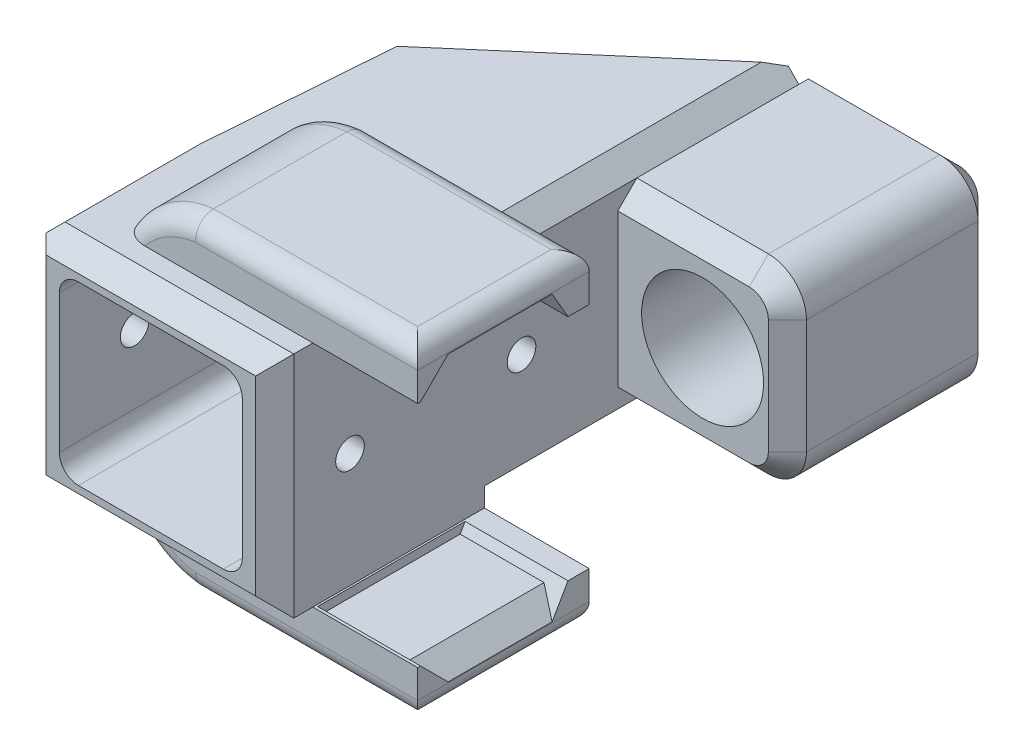
from build123d import *

# Parameters (mm, degrees)
SKETCH2_W                = 13
SKETCH2_H                = 12
BOSS_EXTRUDE3_DEPTH      = 29
CUT_EXTRUDE2_DEPTH       = 17.2
SKETCH5_W                = 15.5
SKETCH5_H                = 2.5
CUT_EXTRUDE3_DEPTH       = 2
CHAMFER4_SIZE            = 1
SKETCH6_W                = 15.5
SKETCH6_H                = 18
CUT_EXTRUDE4_DEPTH       = 2.5
SKETCH8_W                = 15.5
SKETCH8_H                = 18
CUT_EXTRUDE5_DEPTH       = 2.5
BOSS_EXTRUDE4_DEPTH      = 8.9
SKETCH10_R               = 3.2
CUT_EXTRUDE6_DEPTH       = 11
SKETCH11_W               = 13
SKETCH11_H               = 12
CUT_EXTRUDE7_DEPTH       = 1.5
FILLET1_R                = 2
CHAMFER5_SIZE            = 1
CUT_EXTRUDE9_DEPTH       = 36.894428537
CHAMFER6_SIZE            = 1
CHAMFER6_SIZE_2          = 9.42392311
CUT_EXTRUDE11_DEPTH      = 11.5
CHAMFER7_SIZE            = 1
FILLET2_R                = 1
CUT_EXTRUDE12_DEPTH      = 33.897568325
CUT_EXTRUDE12_DEPTH_BACK = 33.897568325
SKETCH17_R               = 0.75
BOSS_EXTRUDE5_START      = -0.2
SKETCH18_R               = 0.795097265
SKETCH18_R_2             = 0.75
BOSS_EXTRUDE5_DEPTH      = 0.2
SKETCH19_W               = 5.4
SKETCH19_H               = 6.7
CUT_EXTRUDE13_DEPTH      = 6.45
CHAMFER8_SIZE            = 0.75
CHAMFER9_SIZE            = 0.288675135
CHAMFER9_SIZE_2          = 0.5
CHAMFER10_SIZE           = 1


with BuildPart() as part:
    # Sketch2 → Boss-Extrude3 (new body)
    with BuildSketch(Plane.XY):
        Polygon((-3.5, 8.5), (-3.5, 6), (6.5, 6), (12, 6), (12, 8.5), align=None)
        Rectangle(SKETCH2_W, SKETCH2_H)
        Polygon((12, -6), (6.5, -6), (-3.5, -6), (-3.5, -8.5), (12, -8.5), align=None)
    extrude(amount=-BOSS_EXTRUDE3_DEPTH)

    # Sketch4 → Cut-Extrude2 (cut)
    with BuildSketch(Plane.XY):
        with BuildLine():
            Line((-3.8, -4.625), (3.8, -4.625))
            ThreePointArc((3.8, -4.625), (4.507106781, -4.332106781), (4.8, -3.625))
            Line((4.8, -3.625), (4.8, 3.625))
            ThreePointArc((4.8, 3.625), (4.507106781, 4.332106781), (3.8, 4.625))
            Line((3.8, 4.625), (-3.8, 4.625))
            ThreePointArc((-3.8, 4.625), (-4.507106781, 4.332106781), (-4.8, 3.625))
            Line((-4.8, 3.625), (-4.8, -3.625))
            ThreePointArc((-4.8, -3.625), (-4.507106781, -4.332106781), (-3.8, -4.625))
        make_face()
    extrude(amount=-CUT_EXTRUDE2_DEPTH, mode=Mode.SUBTRACT)

    # Sketch5 → Cut-Extrude3 (cut)
    with BuildSketch(Plane.XY):
        with Locations((4.25, 7.25)):
            Rectangle(SKETCH5_W, SKETCH5_H)
        with Locations((4.25, -7.25)):
            Rectangle(SKETCH5_W, SKETCH5_H)
    extrude(amount=-CUT_EXTRUDE3_DEPTH, mode=Mode.SUBTRACT)

    # Chamfer4
    chamfer4_edges = [part.edges().sort_by_distance(p)[0] for p in [
        (6.5, 0, 0),
        (0, -6, 0),
        (-6.5, 0, 0),
        (0, 6, 0),
    ]]
    chamfer(chamfer4_edges, length=CHAMFER4_SIZE)

    # Sketch6 → Cut-Extrude4 (cut)
    with BuildSketch(Plane(origin=(0, 8.5, 0), x_dir=(1, 0, 0), z_dir=(0, 1, 0))):
        with Locations((4.25, 20)):
            Rectangle(SKETCH6_W, SKETCH6_H)
    extrude(amount=-CUT_EXTRUDE4_DEPTH, mode=Mode.SUBTRACT)

    # Sketch8 → Cut-Extrude5 (cut)
    with BuildSketch(Plane.XZ.offset(8.5)):
        with Locations((4.25, -20)):
            Rectangle(SKETCH8_W, SKETCH8_H)
    extrude(amount=-CUT_EXTRUDE5_DEPTH, mode=Mode.SUBTRACT)

    # Sketch9 → Boss-Extrude4 (add)
    with BuildSketch(Plane(origin=(6.5, 0, 0), x_dir=(0, 0, -1), z_dir=(1, 0, 0))):
        Polygon((18, 0), (18, 5), (29, 5), (29, -5), (18, -5), align=None)
    extrude(amount=BOSS_EXTRUDE4_DEPTH)

    # Sketch10 → Cut-Extrude6 (cut)
    with BuildSketch(Plane.XY.offset(-18)):
        with Locations((10.95, 0)):
            Circle(SKETCH10_R)
    extrude(amount=-CUT_EXTRUDE6_DEPTH, mode=Mode.SUBTRACT)

    # Sketch11 → Cut-Extrude7 (cut)
    with BuildSketch(Plane(origin=(0, 0, -29), x_dir=(-1, 0, 0), z_dir=(0, 0, -1))):
        Rectangle(SKETCH11_W, SKETCH11_H)
    extrude(amount=-CUT_EXTRUDE7_DEPTH, mode=Mode.SUBTRACT)

    # Fillet1
    fillet1_edges = [part.edges().sort_by_distance(p)[0] for p in [
        (15.4, -5, -23.5),
        (15.4, 5, -23.5),
    ]]
    fillet(fillet1_edges, radius=FILLET1_R)

    # Chamfer5
    chamfer5_edges = [part.edges().sort_by_distance(p)[0] for p in [
        (6.5, 0, -29),
        (15.4, 0, -18),
        (15.4, 0, -29),
        (9.95, -5, -18),
        (9.95, 5, -18),
        (14.814213562, -4.414213562, -18),
        (14.814213562, 4.414213562, -18),
        (9.95, 5, -29),
        (9.95, -5, -29),
        (14.814213562, -4.414213562, -29),
        (14.814213562, 4.414213562, -29),
    ]]
    chamfer(chamfer5_edges, length=CHAMFER5_SIZE)

    # Sketch14 → Cut-Extrude9 (cut, through all)
    with BuildSketch(Plane(origin=(0, 6, 0), x_dir=(1, 0, 0), z_dir=(0, 1, 0))):
        Polygon((-6.5, 27.5), (-6.5, 17.523527678), (5.1, 27.5), align=None)
    extrude(amount=-CUT_EXTRUDE9_DEPTH, mode=Mode.SUBTRACT)

    # Chamfer6
    # the kernel refuses this chamfer: 9.42392311, 1 mm, written as the material it takes off along each edge
    with BuildSketch(Plane(origin=(-6.5, 30.49964556, -17.523527678), x_dir=(0.6076323251889422, 0, -0.794218456966016), z_dir=(0, -1, 0))) as chamfer6_piece_1:
        Polygon((CHAMFER6_SIZE * 0.978564276214, CHAMFER6_SIZE * 0.205941635709), (-CHAMFER6_SIZE_2 * 0.794218456941, CHAMFER6_SIZE_2 * 0.60763232517), (0, 0), align=None)
    extrude(amount=60.999291121, mode=Mode.SUBTRACT)
    # the kernel refuses this chamfer: 9.42392311, 1 mm, written as the material it takes off along each edge
    with BuildSketch(Plane(origin=(-7.691602788, -6, -16.498700761), x_dir=(0.6518104828071479, -0.027495876610586452, 0.757883283409872), z_dir=(0.7581699346405228, 0, -0.6520570145372148))) as chamfer6_2_piece_1:
        Polygon((CHAMFER6_SIZE * 0.999621916911, -CHAMFER6_SIZE * 0.0274958766106), (-CHAMFER6_SIZE * 0.0274958766106, -CHAMFER6_SIZE * 0.999621916911), (0, 0), align=None)
    extrude(amount=19.443365976, mode=Mode.SUBTRACT)
    with BuildSketch(Plane(origin=(-7.691602788, 6, -16.498700761), x_dir=(0.6518104828071478, 0.02749587661058648, 0.757883283409872), z_dir=(0.7581699346405228, 0, -0.6520570145372148))) as chamfer6_2_piece_2:
        Polygon((CHAMFER6_SIZE * 0.999621916911, CHAMFER6_SIZE * 0.0274958766106), (-CHAMFER6_SIZE * 0.0274958766106, CHAMFER6_SIZE * 0.999621916911), (0, 0), align=None)
    extrude(amount=19.443365976, mode=Mode.SUBTRACT)

    # Sketch16 → Cut-Extrude11 (cut)
    with BuildSketch(Plane.XY.offset(-2)):
        with BuildLine():
            ThreePointArc((-3.5, 6), (-1.902802726, 7.706126426), (0.295303565, 8.5))
            Line((0.295303565, 8.5), (-3.5, 8.5))
            Line((-3.5, 8.5), (-3.5, 6))
        make_face()
        with BuildLine():
            Line((-3.5, -8.5), (0.295303565, -8.5))
            ThreePointArc((0.295303565, -8.5), (-1.902802726, -7.706126426), (-3.5, -6))
            Line((-3.5, -6), (-3.5, -8.5))
        make_face()
    extrude(amount=-CUT_EXTRUDE11_DEPTH, mode=Mode.SUBTRACT)

    # Chamfer7
    # the kernel refuses this chamfer: 1 mm, written as the material it takes off along each edge
    with BuildSketch(Plane(origin=(6.5, -6, -11), x_dir=(0.027495876610586487, 0.9996219169112968, 0), z_dir=(0, 0, -1))) as chamfer7_piece_1:
        Polygon((CHAMFER7_SIZE * 0.999621916911, -CHAMFER7_SIZE * 0.0274958766106), (-CHAMFER7_SIZE * 0.0274958766106, -CHAMFER7_SIZE * 0.999621916911), (0, 0), align=None)
    extrude(amount=18.956774475, mode=Mode.SUBTRACT)
    with BuildSketch(Plane(origin=(-6.5, -6, 1.571682988), x_dir=(0.9996219169112968, -0.027495876610586487, 0), z_dir=(0, 0, -1))) as chamfer7_piece_2:
        Polygon((CHAMFER7_SIZE * 0.999621916911, -CHAMFER7_SIZE * 0.0274958766106), (-CHAMFER7_SIZE * 0.0274958766106, -CHAMFER7_SIZE * 0.999621916911), (0, 0), align=None)
    extrude(amount=12.242970544, mode=Mode.SUBTRACT)
    with BuildSketch(Plane(origin=(-5.654981471, -6, -19.329791256), x_dir=(0.9968040214884636, -0.02749587661058647, 0.07500479660556608), z_dir=(-0.0750331653764868, 0, 0.9971810387756)), Plane(origin=(-6.692961515, 6, -5.535171055), x_dir=(0.9968040214884636, 0.027495876610586487, 0.07500479660556608), z_dir=(0.0750331653764868, 0, -0.9971810387756))) as chamfer7_piece_3:
        Polygon((CHAMFER7_SIZE * 0.999621916911, CHAMFER7_SIZE * 0.0274958766106), (-CHAMFER7_SIZE * 0.0274958766106, CHAMFER7_SIZE * 0.999621916911), (0, 0), align=None)
    extrude(amount=13.833616631, mode=Mode.SUBTRACT)
    with BuildSketch(Plane(origin=(6.5, 6, -11), x_dir=(0.027495876610586487, -0.9996219169112968, 0), z_dir=(0, 0, -1))) as chamfer7_piece_4:
        Polygon((CHAMFER7_SIZE * 0.999621916911, CHAMFER7_SIZE * 0.0274958766106), (-CHAMFER7_SIZE * 0.0274958766106, CHAMFER7_SIZE * 0.999621916911), (0, 0), align=None)
    extrude(amount=18.956774475, mode=Mode.SUBTRACT)
    with BuildSketch(Plane(origin=(-6.5, 6, 1.571682988), x_dir=(0.9996219169112968, 0.027495876610586487, 0), z_dir=(0, 0, -1))) as chamfer7_piece_5:
        Polygon((CHAMFER7_SIZE * 0.999621916911, CHAMFER7_SIZE * 0.0274958766106), (-CHAMFER7_SIZE * 0.0274958766106, CHAMFER7_SIZE * 0.999621916911), (0, 0), align=None)
    extrude(amount=12.242970544, mode=Mode.SUBTRACT)

    # Fillet2
    # the kernel refuses this fillet: 1 mm, written as the material it takes off along each edge
    with BuildSketch(Plane(origin=(12, 8.5, -1), x_dir=(-1, 0, 0), z_dir=(0, 0, -1))) as fillet2_piece_1:
        with BuildLine():
            CenterArc((FILLET2_R, -FILLET2_R), FILLET2_R, 90, 90)
            Line((0, -FILLET2_R), (-FILLET2_R * 0.02, -FILLET2_R))
            Line((-FILLET2_R * 0.02, -FILLET2_R), (-FILLET2_R * 0.02, FILLET2_R * 0.02))
            Line((-FILLET2_R * 0.02, FILLET2_R * 0.02), (FILLET2_R, FILLET2_R * 0.02))
            Line((FILLET2_R, FILLET2_R * 0.02), (FILLET2_R, 0))
        make_face()
    extrude(amount=11, mode=Mode.SUBTRACT)
    with BuildSketch(Plane(origin=(12, -8.5, -1), x_dir=(-1, 0, 0), z_dir=(0, 0, -1))) as fillet2_piece_2:
        with BuildLine():
            CenterArc((FILLET2_R, FILLET2_R), FILLET2_R, 180, 90)
            Line((0, FILLET2_R), (-FILLET2_R * 0.02, FILLET2_R))
            Line((-FILLET2_R * 0.02, FILLET2_R), (-FILLET2_R * 0.02, -FILLET2_R * 0.02))
            Line((-FILLET2_R * 0.02, -FILLET2_R * 0.02), (FILLET2_R, -FILLET2_R * 0.02))
            Line((FILLET2_R, -FILLET2_R * 0.02), (FILLET2_R, 0))
        make_face()
    extrude(amount=11, mode=Mode.SUBTRACT)
    with BuildSketch(Plane(origin=(13, -8.5, -11), x_dir=(0, 1, 0), z_dir=(-1, 0, 0))) as fillet2_piece_3:
        with BuildLine():
            CenterArc((FILLET2_R, -FILLET2_R), FILLET2_R, 90, 90)
            Line((0, -FILLET2_R), (-FILLET2_R * 0.02, -FILLET2_R))
            Line((-FILLET2_R * 0.02, -FILLET2_R), (-FILLET2_R * 0.02, FILLET2_R * 0.02))
            Line((-FILLET2_R * 0.02, FILLET2_R * 0.02), (FILLET2_R, FILLET2_R * 0.02))
            Line((FILLET2_R, FILLET2_R * 0.02), (FILLET2_R, 0))
        make_face()
    extrude(amount=13.704696435, mode=Mode.SUBTRACT)
    with BuildSketch(Plane(origin=(0.847651782, -3.530602507, -11), x_dir=(-0.9503253721625865, -0.31125823205827297, 0), z_dir=(-0.31125823205827297, 0.9503253721625865, 0))) as fillet2_piece_4_section:
        with BuildLine():
            CenterArc((5 - FILLET2_R, FILLET2_R), FILLET2_R, 270, 90)
            Line((5, FILLET2_R), (5 + FILLET2_R * 0.02, FILLET2_R))
            Line((5 + FILLET2_R * 0.02, FILLET2_R), (5 + FILLET2_R * 0.02, -FILLET2_R * 0.02))
            Line((5 + FILLET2_R * 0.02, -FILLET2_R * 0.02), (5 - FILLET2_R, -FILLET2_R * 0.02))
            Line((5 - FILLET2_R, -FILLET2_R * 0.02), (5 - FILLET2_R, 0))
        make_face()
    fillet2_piece_4 = revolve(axis=Axis((0.847651782, -3.530602507, -11), (0, 0, 1)), revolution_arc=76.983353639, mode=Mode.PRIVATE)
    fillet2_piece_4 = split(fillet2_piece_4, bisect_by=Plane(origin=(-1.33988421, -6, -10.714938554), z_dir=(0, -1, 0)), keep=Keep.TOP, mode=Mode.PRIVATE)
    add(fillet2_piece_4, mode=Mode.SUBTRACT)
    with BuildSketch(Plane(origin=(13, 8.5, -11), x_dir=(0, -1, 0), z_dir=(-1, 0, 0)), Plane(origin=(-0.704696435, -8.5, -2), x_dir=(0, 0, -1), z_dir=(1, 0, 0)), Plane(origin=(13, 8.5, -2), x_dir=(0, 0, -1), z_dir=(-1, 0, 0))) as fillet2_piece_5:
        with BuildLine():
            CenterArc((FILLET2_R, FILLET2_R), FILLET2_R, 180, 90)
            Line((0, FILLET2_R), (-FILLET2_R * 0.02, FILLET2_R))
            Line((-FILLET2_R * 0.02, FILLET2_R), (-FILLET2_R * 0.02, -FILLET2_R * 0.02))
            Line((-FILLET2_R * 0.02, -FILLET2_R * 0.02), (FILLET2_R, -FILLET2_R * 0.02))
            Line((FILLET2_R, -FILLET2_R * 0.02), (FILLET2_R, 0))
        make_face()
    extrude(amount=13.704696435, mode=Mode.SUBTRACT)
    with BuildSketch(Plane(origin=(0.847651782, 3.530602507, -11), x_dir=(0.08921463778301607, 0.9960124238207299, 0), z_dir=(0.9960124238207299, -0.08921463778301607, 0))) as fillet2_piece_6_section:
        with BuildLine():
            CenterArc((5 - FILLET2_R, FILLET2_R), FILLET2_R, 270, 90)
            Line((5, FILLET2_R), (5 + FILLET2_R * 0.02, FILLET2_R))
            Line((5 + FILLET2_R * 0.02, FILLET2_R), (5 + FILLET2_R * 0.02, -FILLET2_R * 0.02))
            Line((5 + FILLET2_R * 0.02, -FILLET2_R * 0.02), (5 - FILLET2_R, -FILLET2_R * 0.02))
            Line((5 - FILLET2_R, -FILLET2_R * 0.02), (5 - FILLET2_R, 0))
        make_face()
    fillet2_piece_6 = revolve(axis=Axis((0.847651782, 3.530602507, -11), (0, 0, 1)), revolution_arc=76.983353639, mode=Mode.PRIVATE)
    fillet2_piece_6 = split(fillet2_piece_6, bisect_by=Plane(origin=(-1.339884211, 6, -10.714938555), z_dir=(0, 1, 0)), keep=Keep.TOP, mode=Mode.PRIVATE)
    add(fillet2_piece_6, mode=Mode.SUBTRACT)
    with BuildSketch(Plane(origin=(0.847651782, -3.530602507, -2), x_dir=(0.08921463778301987, -0.9960124238207294, 0), z_dir=(0.9960124238207294, 0.08921463778301987, 0))) as fillet2_piece_7_section:
        with BuildLine():
            CenterArc((5 - FILLET2_R, FILLET2_R), FILLET2_R, 270, 90)
            Line((5 - FILLET2_R, 0), (5 - FILLET2_R, -FILLET2_R * 0.02))
            Line((5 - FILLET2_R, -FILLET2_R * 0.02), (5 + FILLET2_R * 0.02, -FILLET2_R * 0.02))
            Line((5 + FILLET2_R * 0.02, -FILLET2_R * 0.02), (5 + FILLET2_R * 0.02, FILLET2_R))
            Line((5 + FILLET2_R * 0.02, FILLET2_R), (5, FILLET2_R))
        make_face()
    fillet2_piece_7 = revolve(axis=Axis((0.847651782, -3.530602507, -2), (0, 0, -1)), revolution_arc=76.983353639, mode=Mode.PRIVATE)
    fillet2_piece_7 = split(fillet2_piece_7, bisect_by=Plane(origin=(-1.33988421, -6, -2.285061446), z_dir=(0, -1, 0)), keep=Keep.TOP, mode=Mode.PRIVATE)
    add(fillet2_piece_7, mode=Mode.SUBTRACT)
    with BuildSketch(Plane(origin=(0.847651782, 3.530602507, -2), x_dir=(-0.9503253721625862, 0.31125823205827374, 0), z_dir=(-0.31125823205827374, -0.9503253721625862, 0))) as fillet2_piece_8_section:
        with BuildLine():
            CenterArc((5 - FILLET2_R, FILLET2_R), FILLET2_R, 270, 90)
            Line((5 - FILLET2_R, 0), (5 - FILLET2_R, -FILLET2_R * 0.02))
            Line((5 - FILLET2_R, -FILLET2_R * 0.02), (5 + FILLET2_R * 0.02, -FILLET2_R * 0.02))
            Line((5 + FILLET2_R * 0.02, -FILLET2_R * 0.02), (5 + FILLET2_R * 0.02, FILLET2_R))
            Line((5 + FILLET2_R * 0.02, FILLET2_R), (5, FILLET2_R))
        make_face()
    fillet2_piece_8 = revolve(axis=Axis((0.847651782, 3.530602507, -2), (0, 0, -1)), revolution_arc=76.983353639, mode=Mode.PRIVATE)
    fillet2_piece_8 = split(fillet2_piece_8, bisect_by=Plane(origin=(-1.33988421, 6, -2.285061446), z_dir=(0, 1, 0)), keep=Keep.TOP, mode=Mode.PRIVATE)
    add(fillet2_piece_8, mode=Mode.SUBTRACT)

    # Sketch17 → Cut-Extrude12 (cut, two sides: drawn at the far end of the back side and taken through both)
    with BuildSketch(Plane(origin=(6.5, 0, 0), x_dir=(0, 0, -1), z_dir=(1, 0, 0)).offset(-CUT_EXTRUDE12_DEPTH_BACK)):
        with Locations(Location((3.95, 0, 0), (0, 0, 90))):
            Circle(SKETCH17_R)
        with Locations(Location((12.95, 0, 0), (0, 0, 180))):
            Circle(SKETCH17_R)
    extrude(amount=CUT_EXTRUDE12_DEPTH + CUT_EXTRUDE12_DEPTH_BACK, mode=Mode.SUBTRACT)

    # Sketch18 → Boss-Extrude5 (add)
    with BuildSketch(Plane.ZY.offset(-4.8).offset(BOSS_EXTRUDE5_START)):
        with Locations((-12.95, 0)):
            Circle(SKETCH18_R)
        with Locations(Location((-3.95, 0, 0), (0, 0, 90))):
            Circle(SKETCH18_R_2)
    extrude(amount=BOSS_EXTRUDE5_DEPTH)

    # Sketch19 → Cut-Extrude13 (cut, symmetric)
    with BuildSketch(Plane(origin=(0, 0, 0), x_dir=(-1, 0, 0), z_dir=(0, -1, 0))):
        with Locations((-9.3, 6.25)):
            Rectangle(SKETCH19_W, SKETCH19_H)
    extrude(amount=CUT_EXTRUDE13_DEPTH, both=True, mode=Mode.SUBTRACT)

    # Chamfer8
    # the kernel refuses this chamfer: 0.75 mm, written as the material it takes off along each edge
    with BuildSketch(Plane(origin=(13.928762241, -6, -2.9), x_dir=(0, 0.02749587661058678, 0.9996219169112968), z_dir=(-1, 0, 0))) as chamfer8_piece_1_section:
        Polygon((CHAMFER8_SIZE * 0.999621916911, -CHAMFER8_SIZE * 0.0274958766106), (-CHAMFER8_SIZE * 0.0274958766106, -CHAMFER8_SIZE * 0.999621916911), (0, 0), align=None)
    chamfer8_piece_1 = extrude(amount=7.328762241, mode=Mode.PRIVATE)
    chamfer8_piece_1 = split(chamfer8_piece_1, bisect_by=Plane(origin=(10.26438112, -6.45, -2.618742905), z_dir=(0, 1, 0)), keep=Keep.TOP, mode=Mode.PRIVATE)
    add(chamfer8_piece_1, mode=Mode.SUBTRACT)
    with BuildSketch(Plane(origin=(6.6, 6, -2.9), x_dir=(0, -0.02749587661058678, 0.9996219169112968), z_dir=(1, 0, 0))) as chamfer8_piece_2_section:
        Polygon((CHAMFER8_SIZE * 0.999621916911, -CHAMFER8_SIZE * 0.0274958766106), (-CHAMFER8_SIZE * 0.0274958766106, -CHAMFER8_SIZE * 0.999621916911), (0, 0), align=None)
    chamfer8_piece_2 = extrude(amount=7.328762241, mode=Mode.PRIVATE)
    chamfer8_piece_2 = split(chamfer8_piece_2, bisect_by=Plane(origin=(10.26438112, 6.45, -2.618742905), z_dir=(0, -1, 0)), keep=Keep.TOP, mode=Mode.PRIVATE)
    add(chamfer8_piece_2, mode=Mode.SUBTRACT)

    # Chamfer9
    # the kernel refuses this chamfer: 0.5, 0.288675135 mm, written as the material it takes off along each edge
    with BuildSketch(Plane(origin=(6.6, -6, -9.6), x_dir=(0, 0.057893862402671276, -0.9983227437537925), z_dir=(1, 0, 0))) as chamfer9_piece_1_section:
        Polygon((CHAMFER9_SIZE * 0.998322742353, -CHAMFER9_SIZE * 0.0578938623214), (-CHAMFER9_SIZE_2 * 0.0578938624027, -CHAMFER9_SIZE_2 * 0.998322743754), (0, 0), align=None)
    chamfer9_piece_1 = extrude(amount=6.693542877, mode=Mode.PRIVATE)
    chamfer9_piece_1 = split(chamfer9_piece_1, bisect_by=Plane(origin=(9.946771439, -6.45, -9.694765745), z_dir=(0, 1, 0)), keep=Keep.TOP, mode=Mode.PRIVATE)
    add(chamfer9_piece_1, mode=Mode.SUBTRACT)
    with BuildSketch(Plane(origin=(13.293542877, 6, -9.6), x_dir=(0, 0.9998132206222079, 0.019326765612700258), z_dir=(-1, 0, 0))) as chamfer9_piece_2_section:
        Polygon((CHAMFER9_SIZE_2 * 0.999813220622, CHAMFER9_SIZE_2 * 0.0193267656127), (-CHAMFER9_SIZE * 0.0193267655856, CHAMFER9_SIZE * 0.999813219219), (0, 0), align=None)
    chamfer9_piece_2 = extrude(amount=6.693542877, mode=Mode.PRIVATE)
    chamfer9_piece_2 = split(chamfer9_piece_2, bisect_by=Plane(origin=(9.946771439, 6.45, -9.694765745), z_dir=(0, -1, 0)), keep=Keep.TOP, mode=Mode.PRIVATE)
    add(chamfer9_piece_2, mode=Mode.SUBTRACT)

    # Chamfer10
    chamfer10_edges = [part.edges().sort_by_distance(p)[0] for p in [
        (12, 6.45, -6.114433757),
        (12, -6.45, -6.114433757),
    ]]
    chamfer(chamfer10_edges, length=CHAMFER10_SIZE)


solid = part.part
